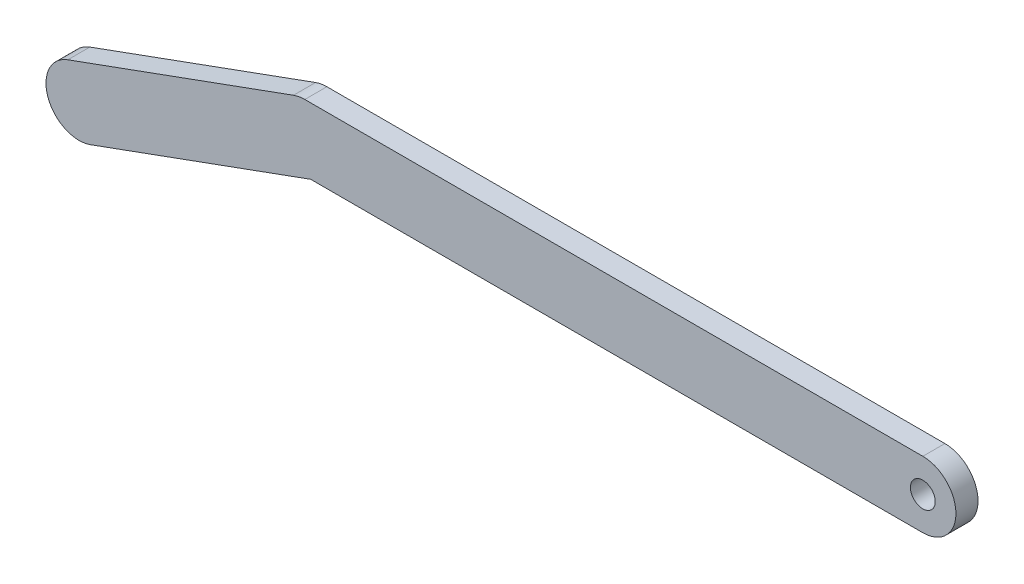
from build123d import *

# Parameters (mm, degrees)
BOSS_EXTRUDE1_DEPTH             = 3.175
F_9_64_0_14063_DIAMETER_HOLE1_D = 3.572002


with BuildPart() as part:
    # Sketch1 → Boss-Extrude1 (new body)
    with BuildSketch(Plane.XY):
        with BuildLine():
            Line((-43.610242754, -4.7625), (44.45, -4.7625))
            ThreePointArc((44.45, -4.7625), (49.2125, 0), (44.45, 4.7625))
            Line((44.45, 4.7625), (-44.45, 4.7625))
            ThreePointArc((-44.45, 4.7625), (-45.276999446, 4.690146924), (-46.078870933, 4.475286106))
            Line((-46.078870933, 4.475286106), (-78.546042472, -7.341797925))
            ThreePointArc((-78.546042472, -7.341797925), (-81.392457646, -13.445954964), (-75.288300607, -16.292370138))
            Line((-75.288300607, -16.292370138), (-43.610242754, -4.7625))
        make_face()
    extrude(amount=BOSS_EXTRUDE1_DEPTH)

    # 9/64 (0.14063) Diameter Hole1 (through all)
    with Locations(Plane.XY.offset(3.175)):
        with Locations((44.45, 0)):
            Hole(F_9_64_0_14063_DIAMETER_HOLE1_D / 2)


solid = part.part
